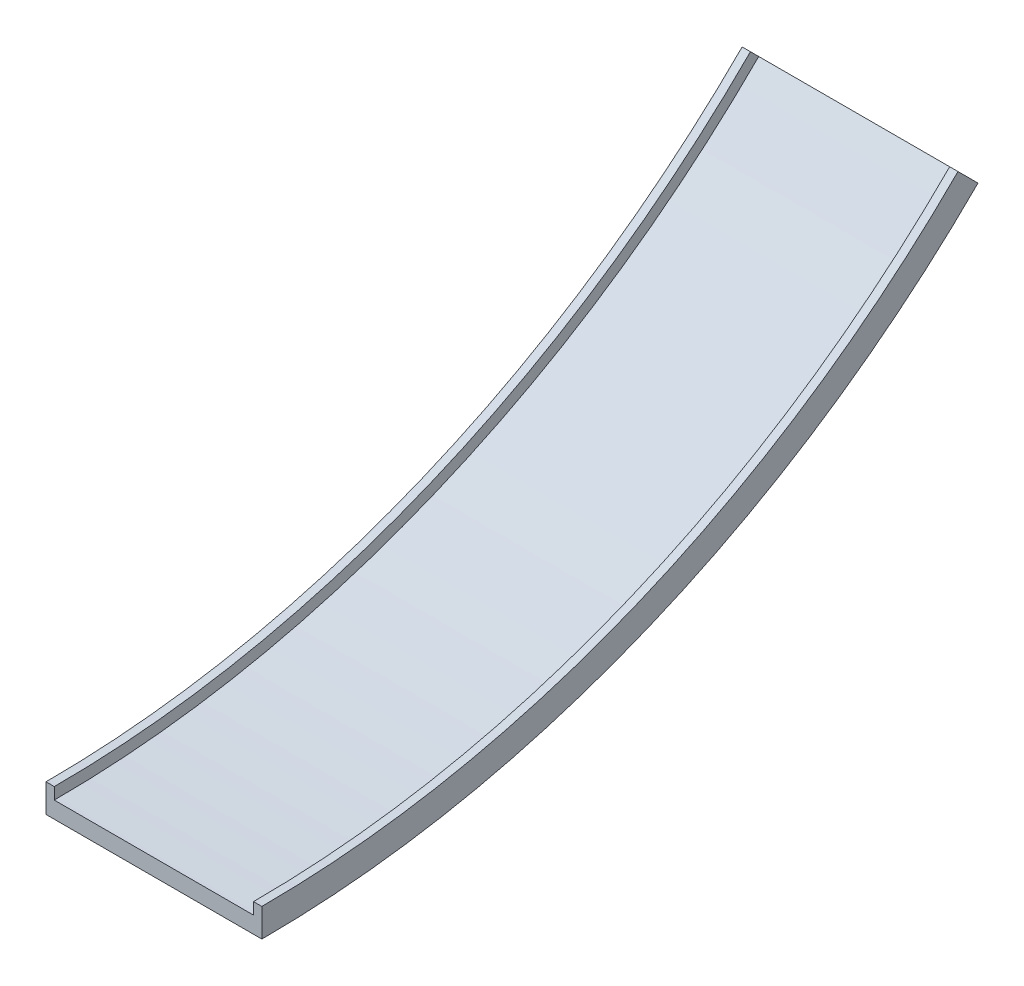
from build123d import *

# Parameters (mm, degrees)
REVOLVE1_ANGLE = 45


with BuildPart() as part:
    # Sketch1 → Revolve1 (revolve)
    with BuildSketch(Plane.XY):
        Polygon((25, 0), (0, 0), (0, -85.236081748), (650, -85.236081748), (650, 0), (625, 0), (625, -35.236081748), (25, -35.236081748), align=None)
    revolve(axis=Axis((0, 2964.763918252, 0), (1, 0, 0)), revolution_arc=REVOLVE1_ANGLE)


solid = part.part
